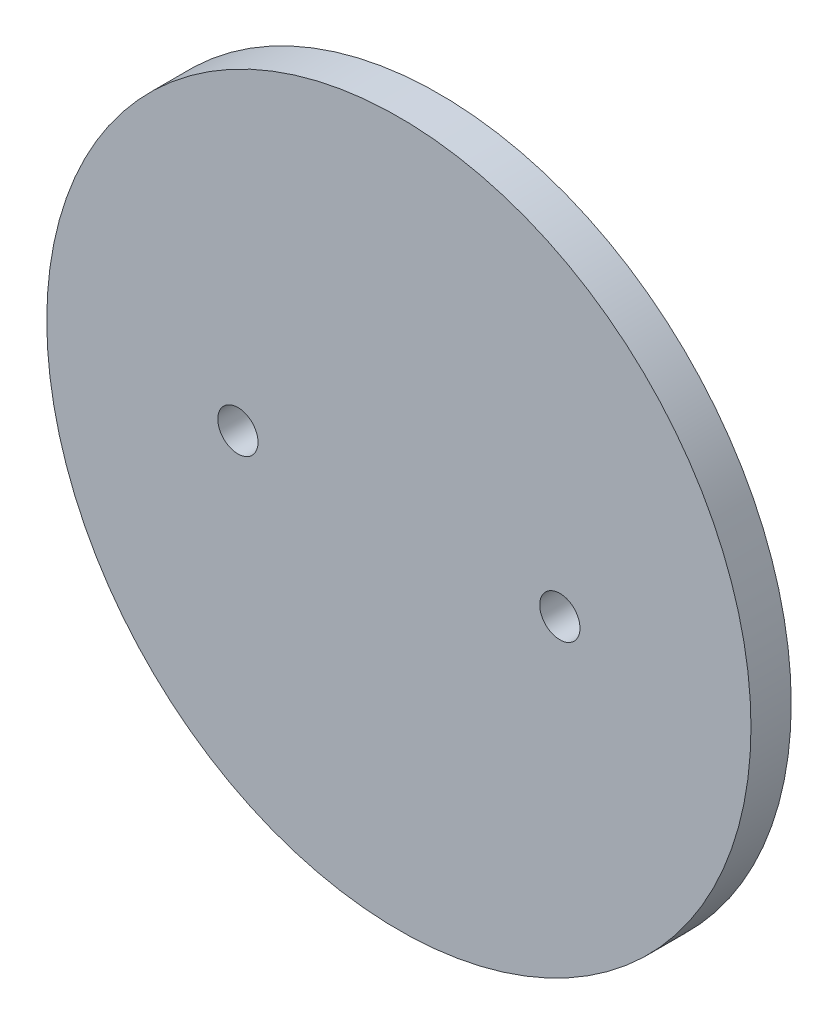
from build123d import *

# Parameters (mm, degrees)
SKETCH1_R           = 22.225
BOSS_EXTRUDE1_DEPTH = 2.54
SKETCH2_R           = 1.27
CUT_EXTRUDE1_DEPTH  = 32.533360906


with BuildPart() as part:
    # Sketch1 → Boss-Extrude1 (new body)
    with BuildSketch(Plane.XY):
        Circle(SKETCH1_R)
    extrude(amount=BOSS_EXTRUDE1_DEPTH)

    # Sketch2 → Cut-Extrude1 (cut, through all)
    with BuildSketch(Plane.XY.offset(2.54)):
        with Locations((-10.16, 0)):
            Circle(SKETCH2_R)
        with Locations((10.16, 0)):
            Circle(SKETCH2_R)
    extrude(amount=-CUT_EXTRUDE1_DEPTH, mode=Mode.SUBTRACT)


solid = part.part
